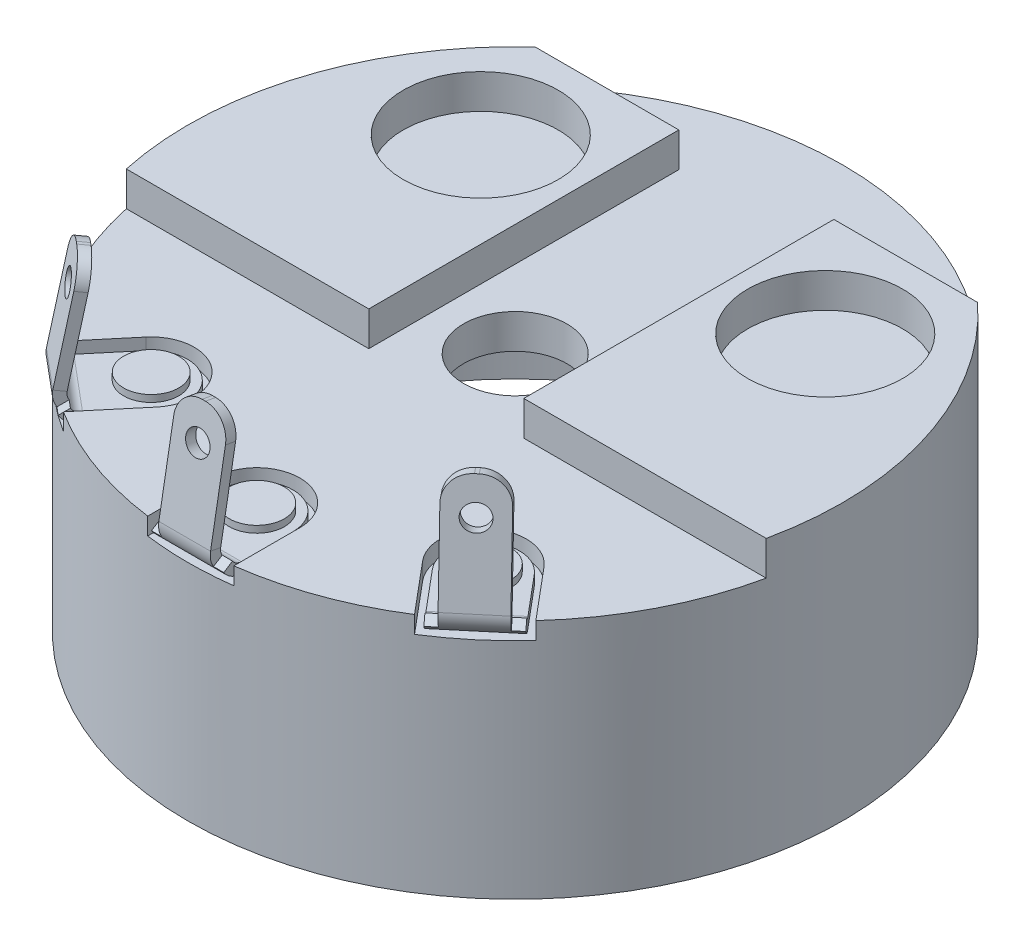
from build123d import *
from build123d.topology import SkipClean

# Parameters (mm, degrees)
SKETCH_1_R               = 4.75
SKETCH_1_R_2             = 0.75
EXTRUDE_1_DEPTH          = 0.5
EXTRUDE_START            = 0.5
SKETCH_1_3_R             = 1.125
EXTRUDE_2_DEPTH          = 0.5
SKETCH_3_R               = 0.375
CUT_EXTRUDE_1_DEPTH      = 7.736096793
SKETCH_3_3_R             = 0.375
CUT_EXTRUDE_2_DEPTH      = 0.25
PATTERN_CIRCULAR_1_COUNT = 3
PATTERN_CIRCULAR_1_ANGLE = 80
EXTRUDE_START_2          = -0.5
SKETCH_1_4_R             = 4.75
SKETCH_1_4_R_2           = 4.5
EXTRUDE_1_2_DEPTH        = 3
SM_START                 = 0.15
SKETCH_13_R              = 0.175
SKETCH_13_R_2            = 0.375
SM_BASE_FLANGE_1_DEPTH   = 0.15
OTHER_START              = -0.525
OTHER_1_DEPTH            = 1.05
OTHER_1_2_DEPTH          = 1.05
OTHER_START_2            = -0.375
OTHER_1_3_DEPTH          = 0.75
OTHER_START_3            = -4.741475404
OTHER_1_4_OUTLINE_R      = 0.175
OTHER_1_4_DEPTH          = 0.149999999
SKETCH_20_R              = 0.375
SM_BASE_FLANGE_2_DEPTH   = 0.15
PATTERN_CIRCULAR_2_COUNT = 3
PATTERN_CIRCULAR_2_ANGLE = 80


with BuildPart() as part:
    # Sketch 1 → Extrude 1 (new body)
    with BuildSketch(Plane(origin=(0, 0, 0), x_dir=(1, 0, 0), z_dir=(0, 1, 0))):
        with Locations(Location((0, 0, 0), (0, 0, 270))):
            Circle(SKETCH_1_R)
        with Locations(Location((0, 0, 0), (0, 0, 270))):
            Circle(SKETCH_1_R_2, mode=Mode.SUBTRACT)
    extrude(amount=-EXTRUDE_1_DEPTH)

    # 草图1<3> → 凸台-拉伸2 (add)
    # profile 1 of 2: a face of its own
    with BuildSketch(Plane(origin=(0, 0, 0), x_dir=(1, 0, 0), z_dir=(0, 1, 0)).offset(EXTRUDE_START)):
        with BuildLine():
            Line((1.125, -1), (4.643543905, -1))
            ThreePointArc((4.643543905, -1), (4.723310997, -0.502825243), (4.75, 0))
            ThreePointArc((4.75, 0), (4.348345299, 1.911646713), (3.211308145, 3.5))
            Line((3.211308145, 3.5), (1.125, 3.5))
            Line((1.125, 3.5), (1.125, -1))
        make_face()
        with Locations(Location((2.5, 2, 0), (0, 0, 270))):
            Circle(SKETCH_1_3_R, mode=Mode.SUBTRACT)
    # profile 2 of 2: a face of its own
    with BuildSketch(Plane(origin=(0, 0, 0), x_dir=(1, 0, 0), z_dir=(0, 1, 0)).offset(EXTRUDE_START)):
        with BuildLine():
            ThreePointArc((-3.211308145, 3.5), (-4.526276083, 1.440598771), (-4.643543905, -1))
            Line((-4.643543905, -1), (-1.125, -1))
            Line((-1.125, -1), (-1.125, 3.5))
            Line((-1.125, 3.5), (-3.211308145, 3.5))
        make_face()
        with Locations(Location((-2.5, 2, 0), (0, 0, 270))):
            Circle(SKETCH_1_3_R, mode=Mode.SUBTRACT)
    extrude(amount=-EXTRUDE_2_DEPTH)

    # 草图3 → 切除-拉伸1 (cut, through all)
    with BuildSketch(Plane(origin=(0, 0, 0), x_dir=(1, 0, 0), z_dir=(0, 1, 0))):
        with Locations(Location((-2.410453536, -2.872666662, 0), (0, 0, 270))):
            Circle(SKETCH_3_R)
    cut_extrude_1 = extrude(amount=-CUT_EXTRUDE_1_DEPTH, mode=Mode.SUBTRACT)

    # 草图3<3> → 切除-拉伸2 (cut)
    with BuildSketch(Plane(origin=(0, 0, 0), x_dir=(1, 0, 0), z_dir=(0, 1, 0))):
        with BuildLine():
            Line((-3.505473113, -3.205332784), (-2.889231313, -2.470924406))
            ThreePointArc((-2.889231313, -2.470924406), (-2.00871128, -2.393888885), (-1.931675759, -3.274408918))
            Line((-1.931675759, -3.274408918), (-2.547917559, -4.008817296))
            ThreePointArc((-2.547917559, -4.008817296), (-3.053241146, -3.638711105), (-3.505473113, -3.205332784))
        make_face()
        with Locations(Location((-2.410453536, -2.872666662, 0), (0, 0, 270))):
            Circle(SKETCH_3_3_R, mode=Mode.SUBTRACT)
    cut_extrude_2 = extrude(amount=-CUT_EXTRUDE_2_DEPTH, mode=Mode.SUBTRACT)

    # 阵列(圆周)1: 切除-拉伸1, 切除-拉伸2 ×3 about axis
    pattern_circular_1_axis = Axis((0, 0, 0), (0, 1, 0))
    add([cut_extrude_1.rotate(pattern_circular_1_axis, i * PATTERN_CIRCULAR_1_ANGLE / (PATTERN_CIRCULAR_1_COUNT - 1)) for i in range(1, PATTERN_CIRCULAR_1_COUNT)], mode=Mode.SUBTRACT)
    add([cut_extrude_2.rotate(pattern_circular_1_axis, i * PATTERN_CIRCULAR_1_ANGLE / (PATTERN_CIRCULAR_1_COUNT - 1)) for i in range(1, PATTERN_CIRCULAR_1_COUNT)], mode=Mode.SUBTRACT)

    # 草图1<4> → Extrude 1 2 (add)
    with BuildSketch(Plane(origin=(0, 0, 0), x_dir=(1, 0, 0), z_dir=(0, 1, 0)).offset(EXTRUDE_START_2)):
        Circle(SKETCH_1_4_R)
        Circle(SKETCH_1_4_R_2, mode=Mode.SUBTRACT)
    extrude(amount=-EXTRUDE_1_2_DEPTH)


with BuildPart() as body_2:
    # 基体-法兰1: sheet metal written as solids
    # 草图13 → 基体-法兰1 (new body)
    with BuildSketch(Plane(origin=(0, -0.25, 0), x_dir=(1, 0, 0), z_dir=(0, 1, 0)).offset(SM_START)):
        with BuildLine():
            Line((-3.313962002, -3.366029686), (-4.213864655, -4.438491907))
            ThreePointArc((-4.213864655, -4.438491907), (-4.294417245, -4.69397208), (-4.170724764, -4.931583125))
            Line((-4.170724764, -4.931583125), (-4.132422542, -4.963722506))
            ThreePointArc((-4.132422542, -4.963722506), (-3.876942368, -5.044275095), (-3.639331323, -4.920582614))
            Line((-3.639331323, -4.920582614), (-2.73942867, -3.848120394))
            Line((-2.73942867, -3.848120394), (-2.624522003, -3.944538535))
            Line((-2.624522003, -3.944538535), (-2.008280204, -3.210130157))
            ThreePointArc((-2.008280204, -3.210130157), (-2.072990041, -2.470493329), (-2.812626869, -2.535203167))
            Line((-2.812626869, -2.535203167), (-3.428868668, -3.269611545))
            Line((-3.428868668, -3.269611545), (-3.313962002, -3.366029686))
        make_face()
        with Locations(Location((-3.830179848, -4.564630594, 0), (0, 0, 270))):
            Circle(SKETCH_13_R, mode=Mode.SUBTRACT)
        with Locations(Location((-2.410453536, -2.872666662, 0), (0, 0, 270))):
            Circle(SKETCH_13_R_2, mode=Mode.SUBTRACT)
    extrude(amount=-SM_BASE_FLANGE_1_DEPTH)

    # Other 1: read off the stored shape, not the designer's step
    # Other 1 outline → Other 1 (cut)
    with BuildSketch(Plane(origin=(0, 0, 0), x_dir=(0.6427876096865404, 0, -0.7660444431189772), z_dir=(0.7660444431189772, 0, 0.6427876096865403)).offset(OTHER_START)):
        with BuildLine():
            Line((-4.760983594, -0.1), (-6.45870205, -0.1))
            Line((-6.45870205, -0.1), (-6.45870205, -0.25))
            Line((-6.45870205, -0.25), (-4.501175973, -0.25))
            ThreePointArc((-4.501175973, -0.25), (-4.651175973, -0.209807621), (-4.760983594, -0.1))
        make_face()
    extrude(amount=OTHER_1_DEPTH, mode=Mode.SUBTRACT)

    # Other 1 2 outline → Other 1 2 (add)
    with SkipClean():  # the faces are left unmerged after this step: merging them gives an invalid solid
        with BuildSketch(Plane(origin=(0, 0, 0), x_dir=(0.6427876096865404, 0, -0.7660444431189772), z_dir=(0.7660444431189772, 0, 0.6427876096865403)).offset(OTHER_START)):
            with BuildLine():
                ThreePointArc((-4.501175973, -0.1), (-4.57325702, -0.081545895), (-4.627602184, -0.030724302))
                Line((-4.627602184, -0.030724302), (-4.754028396, -0.111448605))
                ThreePointArc((-4.754028396, -0.111448605), (-4.73301345, -0.140397963), (-4.70870205, -0.166640087))
                Line((-4.70870205, -0.166640087), (-4.70870205, -0.1))
                Line((-4.70870205, -0.1), (-4.501175973, -0.1))
            make_face()
        extrude(amount=OTHER_1_2_DEPTH)

    # Other 1 3 outline → Other 1 3 (add)
    with SkipClean():  # the faces are left unmerged after this step: merging them gives an invalid solid
        with BuildSketch(Plane(origin=(0, 0, 0), x_dir=(0.6427876096865404, 0, -0.7660444431189772), z_dir=(0.7660444431189772, 0, 0.6427876096865403)).offset(OTHER_START_2)):
            with BuildLine():
                ThreePointArc((-4.627602184, -0.030724302), (-4.648278779, 0.020661214), (-4.648897136, 0.076047227))
                Line((-4.648897136, 0.076047227), (-4.371712461, 1.648039633))
                Line((-4.371712461, 1.648039633), (-4.519433624, 1.674086859))
                Line((-4.519433624, 1.674086859), (-4.796618299, 0.102094453))
                ThreePointArc((-4.796618299, 0.102094453), (-4.796618299, -0.002094454), (-4.760983594, -0.1))
                Line((-4.760983594, -0.1), (-4.736098185, -0.1))
                Line((-4.736098185, -0.1), (-4.627602184, -0.030724302))
            make_face()
        extrude(amount=OTHER_1_3_DEPTH)

    # Other 1 4 outline → Other 1 4 (cut)
    with SkipClean():  # the faces are left unmerged after this step: merging them gives an invalid solid
        with BuildSketch(Plane(origin=(0, 0, 0), x_dir=(0.7741336234862095, 0.14199506630580766, 0.6168910228986324), z_dir=(0.6330222215594896, -0.1736481776669339, -0.7544065067354877)).offset(OTHER_START_3)):
            with BuildLine():
                Line((-0.246525022, -0.908905109), (0.099817711, -0.858440159))
                ThreePointArc((0.099817711, -0.858440159), (-0.159864425, -0.792682829), (-0.296989971, -0.562562375))
                Line((-0.296989971, -0.562562375), (-0.246525022, -0.908905109))
            make_face()
            with BuildLine():
                ThreePointArc((0.445173029, -0.454423198), (0.379415699, -0.714105335), (0.149295245, -0.851230881))
                Line((0.149295245, -0.851230881), (0.495637978, -0.800765932))
                Line((0.495637978, -0.800765932), (0.445173029, -0.454423198))
            make_face()
            with Locations((0.052463694, -0.360060187)):
                Circle(OTHER_1_4_OUTLINE_R)
        extrude(amount=OTHER_1_4_DEPTH, mode=Mode.SUBTRACT)


with BuildPart() as body_3:
    # 基体-法兰2: sheet metal written as solids
    # 草图20 → 基体-法兰2 (new body)
    with BuildSketch(Plane.XZ.offset(0.5)):
        with BuildLine():
            ThreePointArc((-2.828265483, 3.37059555), (0, -4.4), (2.828265483, 3.37059555))
            ThreePointArc((2.828265483, 3.37059555), (1.912524648, 3.290478608), (1.99264159, 2.374737774))
            ThreePointArc((1.99264159, 2.374737774), (0, -3.1), (-1.99264159, 2.374737774))
            ThreePointArc((-1.99264159, 2.374737774), (-1.912524648, 3.290478608), (-2.828265483, 3.37059555))
        make_face()
        with Locations(Location((-2.410453536, 2.872666662, 0), (0, 0, 270))):
            Circle(SKETCH_20_R, mode=Mode.SUBTRACT)
    extrude(amount=SM_BASE_FLANGE_2_DEPTH)


with BuildPart() as body_4:
    # 草图23 → 旋转1 (revolve)
    with BuildSketch(Plane(origin=(0, 0, 0), x_dir=(0.6427876096865349, 0, -0.7660444431189818), z_dir=(0.7660444431189817, 0, 0.6427876096865348)), mode=Mode.PRIVATE) as revolve_1_sk:
        Polygon((-3.375, -0.1), (-3.35, -0.1), (-3.35, 0), (-3.75, 0), (-3.75, -0.650298416), (-3.75, -0.75), (-3.35, -0.75), (-3.35, -0.65), (-3.375, -0.65), align=None)
    revolve(revolve_1_sk.sketch.rotate(Axis((-2.410453536, 0, 2.872666662), (0, -1, 0)), 140), axis=Axis((-2.410453536, 0, 2.872666662), (0, -1, 0)))


with BuildPart() as pattern_circular_2_1:
    # 阵列(圆周)2: pattern copy
    add(body_2.part.rotate(Axis((0, 0, 0), (0, 1, 0)), 1 * PATTERN_CIRCULAR_2_ANGLE / (PATTERN_CIRCULAR_2_COUNT - 1)))


with BuildPart() as pattern_circular_2_2:
    # 阵列(圆周)2: pattern copy
    add(body_2.part.rotate(Axis((0, 0, 0), (0, 1, 0)), 2 * PATTERN_CIRCULAR_2_ANGLE / (PATTERN_CIRCULAR_2_COUNT - 1)))


with BuildPart() as pattern_circular_2_3:
    # 阵列(圆周)2: pattern copy
    add(body_4.part.rotate(Axis((0, 0, 0), (0, 1, 0)), 1 * PATTERN_CIRCULAR_2_ANGLE / (PATTERN_CIRCULAR_2_COUNT - 1)))


with BuildPart() as pattern_circular_2_4:
    # 阵列(圆周)2: pattern copy
    add(body_4.part.rotate(Axis((0, 0, 0), (0, 1, 0)), 2 * PATTERN_CIRCULAR_2_ANGLE / (PATTERN_CIRCULAR_2_COUNT - 1)))


solid = Compound([part.part, body_2.part, body_3.part, body_4.part, pattern_circular_2_1.part, pattern_circular_2_2.part, pattern_circular_2_3.part, pattern_circular_2_4.part])
